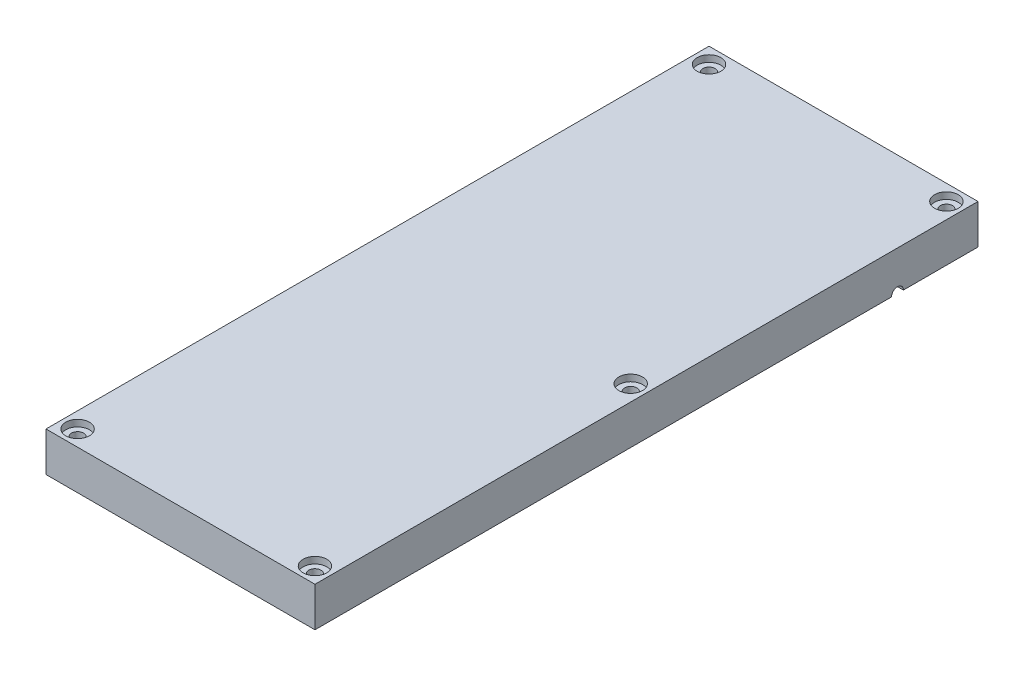
from build123d import *

# Parameters (mm, degrees)
BOSS_EXTRUDE1_START                                 = 15.875
SKETCH1_W                                           = 108.1913
SKETCH1_H                                           = 266.7
BOSS_EXTRUDE1_DEPTH                                 = 15.875
CBORE_FOR_8_BINDING_HEAD_MACHINE_SCREW1_D           = 4.9149
CBORE_FOR_8_BINDING_HEAD_MACHINE_SCREW1_CBORE_D     = 9.525
CBORE_FOR_8_BINDING_HEAD_MACHINE_SCREW1_CBORE_DEPTH = 2.667
SKETCH4_W                                           = 71.9963
SKETCH4_H                                           = 224.79
CUT_EXTRUDE1_DEPTH                                  = 12.7
SKETCH6_R                                           = 2.38125
SKETCH8_W                                           = 12.7
SKETCH8_H                                           = 13.97
SKETCH8_W_2                                         = 13.97
SKETCH8_H_2                                         = 12.7
CUT_EXTRUDE3_DEPTH                                  = 12.7


with BuildPart() as part:
    # Sketch1 → Boss-Extrude1 (new body)
    with BuildSketch(Plane(origin=(0, 0, 0), x_dir=(1, 0, 0), z_dir=(0, 1, 0)).offset(BOSS_EXTRUDE1_START)):
        with Locations((91.95435, 133.35)):
            Rectangle(SKETCH1_W, SKETCH1_H)
    extrude(amount=BOSS_EXTRUDE1_DEPTH)

    # CBORE for #8 Binding Head Machine Screw1 (through all)
    with Locations(Plane(origin=(0, 31.75, 0), x_dir=(1, 0, 0), z_dir=(0, 1, 0))):
        with Locations((139.7, 6.35), (139.7, 260.35), (44.2087, 6.35), (44.2087, 260.35), (139.7, 133.35)):
            CounterBoreHole(CBORE_FOR_8_BINDING_HEAD_MACHINE_SCREW1_D / 2, CBORE_FOR_8_BINDING_HEAD_MACHINE_SCREW1_CBORE_D / 2, CBORE_FOR_8_BINDING_HEAD_MACHINE_SCREW1_CBORE_DEPTH)

    # Sketch4 → Cut-Extrude1 (cut)
    with BuildSketch(Plane(origin=(0, 15.875, 0), x_dir=(-1, 0, 0), z_dir=(0, -1, 0))):
        with Locations((-80.20685, 130.81)):
            Rectangle(SKETCH4_W, SKETCH4_H)
    extrude(amount=-CUT_EXTRUDE1_DEPTH, mode=Mode.SUBTRACT)

    # Cut-Sweep1: sweep along a path in Sketch5
    with BuildLine(Plane.XZ.offset(-15.875)) as cut_sweep1_path:
        Line((116.205, -196.215), (121.92, -196.215))
        Line((121.92, -196.215), (121.92, -234.315))
        Line((121.92, -234.315), (130.81, -234.315))
        Line((130.81, -234.315), (130.81, -158.115))
        Line((130.81, -158.115), (139.7, -158.115))
        Line((139.7, -158.115), (139.7, -234.315))
        Line((139.7, -234.315), (146.05, -234.315))
    # Sketch6 → Cut-Sweep1 (sweep, cut)
    with BuildSketch(Plane(origin=(146.05, 0, 0), x_dir=(0, 0, -1), z_dir=(1, 0, 0))):
        with Locations((234.315, 15.875)):
            Circle(SKETCH6_R)
    sweep(path=cut_sweep1_path.line, transition=Transition.RIGHT, mode=Mode.SUBTRACT)

    # Sketch8 → Cut-Extrude3 (cut)
    with BuildSketch(Plane.XZ.offset(-15.875)):
        with Locations((122.555, -25.4)):
            Rectangle(SKETCH8_W, SKETCH8_H)
        with Locations((109.22, -249.555)):
            Rectangle(SKETCH8_W_2, SKETCH8_H_2)
    extrude(amount=-CUT_EXTRUDE3_DEPTH, mode=Mode.SUBTRACT)


solid = part.part
